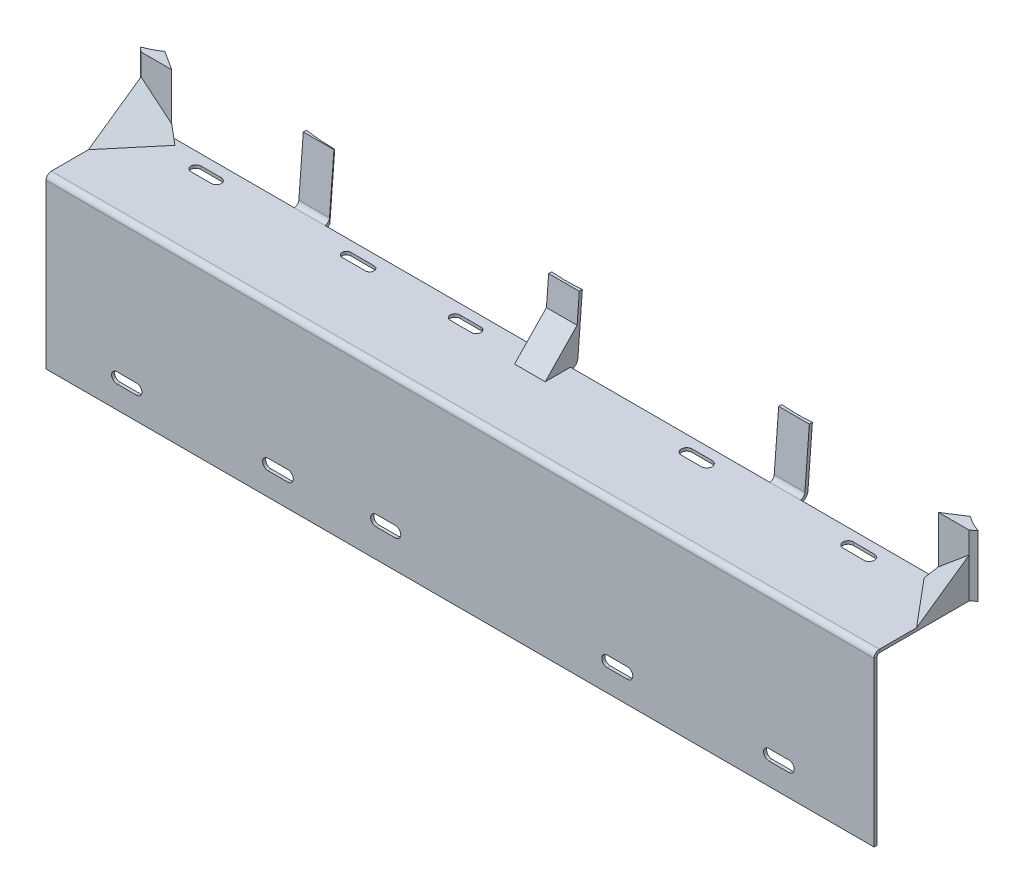
from build123d import *

# Parameters (mm, degrees)
ESQUISSE1_W                           = 270
ESQUISSE1_H                           = 55
T_LE_DE_BASE_PLI_E1_DEPTH             = 1
T_LE_PLI_E_SUR_AR_TE1_STRIP_W         = 5.4732
T_LE_PLI_E_SUR_AR_TE1_STRIP_H         = 1
T_LE_PLI_E_SUR_AR_TE1_STRIP_CUT_DEPTH = 270
T_LE_PLI_E_SUR_AR_TE1_DEPTH           = 270
BOSS_EXTRU_1_START                    = -135
BOSS_EXTRU_1_DEPTH                    = 5
ENL_V_MAT_EXTRU_2_DEPTH               = 283.872177276
BOSS_EXTRU_2_START                    = -10
BOSS_EXTRU_2_DEPTH                    = 10
BOSS_EXTRU_3_DEPTH                    = 20
ENL_V_MAT_EXTRU_7_DEPTH               = 286.069526522
BOSS_EXTRU_4_REACH                    = 239.035
BOSS_EXTRU_4_DIRECTION_2_REACH        = 239.035
R_P_TITION_LIN_AIRE7_COUNT            = 2
R_P_TITION_LIN_AIRE7_PITCH            = 80
R_P_TITION_LIN_AIRE8_COUNT            = 2
R_P_TITION_LIN_AIRE8_PITCH            = 75
ENL_V_MAT_EXTRU_8_DEPTH               = 285.398137951
ESQUISSE53_R                          = 1.75
ENL_V_MAT_EXTRU_9_DEPTH               = 280.175644717
ENL_V_MAT_EXTRU_11_DEPTH              = 280.104628006
ENL_V_MAT_EXTRU_12_DEPTH              = 10
ENL_V_MAT_EXTRU_13_DEPTH              = 280.175644717
ENL_V_MAT_EXTRU_14_DEPTH              = 280.175644717
ENL_V_MAT_EXTRU_15_DEPTH              = 280.175644717
ENL_V_MAT_EXTRU_16_DEPTH              = 280.175644717
ENL_V_MAT_EXTRU_17_DEPTH              = 280.104628006
ENL_V_MAT_EXTRU_18_DEPTH              = 280.104628006


# Sheet-metal steps are written as plain solids
with BuildPart() as part:
    # Esquisse1 → Tôle de base pliée1 (new body)
    with BuildSketch(Plane.XY):
        with Locations((135, -27.5)):
            Rectangle(ESQUISSE1_W, ESQUISSE1_H)
    extrude(amount=-T_LE_DE_BASE_PLI_E1_DEPTH)

    # Tôle pliée sur arête1 strip (across the edge) → Tôle pliée sur arête1 strip cut (cut)
    with BuildSketch(Plane(origin=(0, 0, -1), x_dir=(0, -1, 0), z_dir=(1, 0, 0))):
        with Locations((-1, -0.5)):
            Rectangle(T_LE_PLI_E_SUR_AR_TE1_STRIP_W, T_LE_PLI_E_SUR_AR_TE1_STRIP_H)
    extrude(amount=T_LE_PLI_E_SUR_AR_TE1_STRIP_CUT_DEPTH, mode=Mode.SUBTRACT)

    # Tôle pliée sur arête1 section (across the edge) → Tôle pliée sur arête1 (add)
    with BuildSketch(Plane(origin=(0, 0, -1), x_dir=(0, -1, 0), z_dir=(1, 0, 0))):
        with BuildLine():
            Line((0, 0.7366), (0, 30))
            Line((0, 30), (1, 30))
            Line((1, 30), (1, 0.7366))
            ThreePointArc((1, 0.7366), (1.215745145, 0.215745145), (1.7366, 0))
            Line((1.7366, 0), (1.7366, -1))
            ThreePointArc((1.7366, -1), (0.508638364, -0.491361636), (0, 0.7366))
        make_face()
    extrude(amount=T_LE_PLI_E_SUR_AR_TE1_DEPTH)

    # Esquisse22 → Boss.-Extru.1 (add, symmetric)
    with BuildSketch(Plane.ZY.offset(BOSS_EXTRU_1_START)):
        with BuildLine():
            Line((-31, 0), (-31, -1))
            ThreePointArc((-31, -1), (-32.659310922, -0.260972581), (-33.426330221, 1.385582617))
            Line((-33.426330221, 1.385582617), (-34.881510189, 20))
            Line((-34.881510189, 20), (-33.881510189, 20))
            Line((-33.881510189, 20), (-32.432404413, 1.463282654))
            ThreePointArc((-32.432404413, 1.463282654), (-31.981912691, 0.471537874), (-31, 0))
        make_face()
    boss_extru_1 = extrude(amount=BOSS_EXTRU_1_DEPTH, both=True)

    # Esquisse25 → Enlèv. mat.-Extru.2 (cut, through all)
    with BuildSketch(Plane(origin=(0, 22.588810811, -1.765877723), x_dir=(-1, 0, 0), z_dir=(0, -0.9969582781624381, 0.07793710030137713))):
        with BuildLine():
            Line((-140, 33.216668331), (-130, 33.216668331))
            ThreePointArc((-130, 33.216668331), (-135, 33.000088303), (-140, 33.216668331))
        make_face()
    enl_v_mat_extru_2 = extrude(amount=ENL_V_MAT_EXTRU_2_DEPTH, mode=Mode.SUBTRACT)

    # Esquisse47 → Boss.-Extru.2 (add)
    with BuildSketch(Plane(origin=(140, 0, 0), x_dir=(0, 0, -1), z_dir=(1, 0, 0)).offset(BOSS_EXTRU_2_START)):
        with BuildLine():
            Line((32.432404413, 1.463282654), (33.159380538, 10.762638976))
            Line((33.159380538, 10.762638976), (22.768887784, 0))
            Line((22.768887784, 0), (31, 0))
            ThreePointArc((31, 0), (31.981912691, 0.471537874), (32.432404413, 1.463282654))
        make_face()
    extrude(amount=BOSS_EXTRU_2_DEPTH)

    # Esquisse48 → Boss.-Extru.3 (add)
    with BuildSketch(Plane.XZ.offset(1)):
        Polygon((270, -31), (260, -31), (269.329315013, -36.998343541), (272.799848839, -33.349352128), align=None)
    boss_extru_3 = extrude(amount=-BOSS_EXTRU_3_DEPTH)

    # Esquisse50 → Enlèv. mat.-Extru.7 (cut, through all)
    with BuildSketch(Plane(origin=(0, 19, 0), x_dir=(1, 0, 0), z_dir=(0, 1, 0))):
        with BuildLine():
            ThreePointArc((266.294986337, 35.047402257), (268.836042932, 33.501000515), (271.562175684, 32.31082104))
            Line((271.562175684, 32.31082104), (272.799848839, 33.349352128))
            Line((272.799848839, 33.349352128), (269.329315013, 36.998343541))
            Line((269.329315013, 36.998343541), (266.294986337, 35.047402257))
        make_face()
    enl_v_mat_extru_7 = extrude(amount=-ENL_V_MAT_EXTRU_7_DEPTH, mode=Mode.SUBTRACT)

    # Boss.-Extru.4: up to this face of the body (flat: up to its plane)
    boss_extru_4_end = Plane(part.part.faces().sort_by_distance((263.147493169, 9, -33.023701128))[0])
    # Esquisse51 → Boss.-Extru.4 (add, up to the picked face)
    with BuildSketch(Plane(origin=(96.292975843, 0, 114.757499903), x_dir=(0.766044443118977, -1.5064271830750915e-15, -0.6427876096865406), z_dir=(0.6427876096865406, -2.6746298778743913e-15, 0.766044443118977)), mode=Mode.PRIVATE) as boss_extru_4_sk1:
        Polygon((215.725046737, 0), (226.758415542, 0), (226.758415542, 11.982155567), align=None)
    boss_extru_4_tool1 = split(extrude(boss_extru_4_sk1.sketch, amount=-BOSS_EXTRU_4_REACH, mode=Mode.PRIVATE), bisect_by=boss_extru_4_end, keep=Keep.BOTH, mode=Mode.PRIVATE)
    boss_extru_4 = boss_extru_4_tool1.solids().sort_by(Axis((267.18265, 3.994052, -28.635962), (-0.6427876096865406, 2.6746298778743913e-15, -0.766044443118977)))[0]
    add(boss_extru_4)

    # Boss.-Extru.4 direction 2: up to this face of the body (flat: up to its plane)
    boss_extru_4_direction_2_end = Plane(part.part.faces().sort_by_distance((270, -28.3683, -0.631347765))[0])
    # Esquisse51 → Boss.-Extru.4 direction 2 (add, up to the picked face)
    with BuildSketch(Plane(origin=(96.292975843, 0, 114.757499903), x_dir=(0.766044443118977, -1.5064271830750915e-15, -0.6427876096865406), z_dir=(0.6427876096865406, -2.6746298778743913e-15, 0.766044443118977)), mode=Mode.PRIVATE) as boss_extru_4_direction_2_sk1:
        Polygon((215.725046737, 0), (226.758415542, 0), (226.758415542, 11.982155567), align=None)
    boss_extru_4_direction_2_tool1 = split(extrude(boss_extru_4_direction_2_sk1.sketch, amount=BOSS_EXTRU_4_DIRECTION_2_REACH, mode=Mode.PRIVATE), bisect_by=boss_extru_4_direction_2_end, keep=Keep.BOTH, mode=Mode.PRIVATE)
    boss_extru_4_direction_2 = boss_extru_4_direction_2_tool1.solids().sort_by(Axis((267.18265, 3.994052, -28.635962), (0.6427876096865406, -2.6746298778743913e-15, 0.766044443118977)))[0]
    add(boss_extru_4_direction_2)

    # Symétrie1: Boss.-Extru.3, Enlèv. mat.-Extru.7, Boss.-Extru.4, Boss.-Extru.4 direction 2 across plane
    add(boss_extru_3.mirror(Plane(origin=(135, 0, 0), x_dir=(0, 0, 1), z_dir=(1, 0, 0))))
    add(enl_v_mat_extru_7.mirror(Plane(origin=(135, 0, 0), x_dir=(0, 0, 1), z_dir=(1, 0, 0))), mode=Mode.SUBTRACT)
    add(boss_extru_4.mirror(Plane(origin=(135, 0, 0), x_dir=(0, 0, 1), z_dir=(1, 0, 0))))
    add(boss_extru_4_direction_2.mirror(Plane(origin=(135, 0, 0), x_dir=(0, 0, 1), z_dir=(1, 0, 0))))

    # Répétition linéaire7: Boss.-Extru.1 ×2
    with Locations(*[(-i * R_P_TITION_LIN_AIRE7_PITCH, 0, 0) for i in range(1, R_P_TITION_LIN_AIRE7_COUNT)]):
        add(boss_extru_1)

    # Répétition linéaire8: Boss.-Extru.1, Enlèv. mat.-Extru.2 ×2
    with Locations(*[(i * R_P_TITION_LIN_AIRE8_PITCH, 0, 0) for i in range(1, R_P_TITION_LIN_AIRE8_COUNT)]):
        add(boss_extru_1)
        add(enl_v_mat_extru_2, mode=Mode.SUBTRACT)

    # Esquisse52 → Enlèv. mat.-Extru.8 (cut, through all)
    with BuildSketch(Plane(origin=(0, 22.588810811, -1.765877723), x_dir=(-1, 0, 0), z_dir=(0, -0.9969582781624381, 0.07793710030137713))):
        with BuildLine():
            Line((-60, 33.216668331), (-50, 33.216668331))
            ThreePointArc((-50, 33.216668331), (-54.986411491, 32.662553985), (-60, 32.474744168))
            Line((-60, 32.474744168), (-60, 33.216668331))
        make_face()
    extrude(amount=ENL_V_MAT_EXTRU_8_DEPTH, mode=Mode.SUBTRACT)

    # Esquisse53 → Enlèv. mat.-Extru.9 (cut, through all)
    with BuildSketch(Plane(origin=(0, 0, -1), x_dir=(-1, 0, 0), z_dir=(0, 0, -1))):
        with Locations((-241.94772672, -45.997712975)):
            Circle(ESQUISSE53_R)
    extrude(amount=-ENL_V_MAT_EXTRU_9_DEPTH, mode=Mode.SUBTRACT)

    # Esquisse55 → Enlèv. mat.-Extru.11 (cut, through all)
    with BuildSketch(Plane(origin=(0, -1, 0), x_dir=(-1, 0, 0), z_dir=(0, -1, 0))):
        with BuildLine():
            Line((-189.415802341, 27.756163785), (-182.903972207, 27.756163785))
            ThreePointArc((-182.903972207, 27.756163785), (-181.149560479, 26.001752057), (-182.903972207, 24.247340329))
            Line((-182.903972207, 24.247340329), (-189.415802341, 24.247340329))
            ThreePointArc((-189.415802341, 24.247340329), (-191.170214069, 26.001752057), (-189.415802341, 27.756163785))
        make_face()
    extrude(amount=-ENL_V_MAT_EXTRU_11_DEPTH, mode=Mode.SUBTRACT)

    # Esquisse56 → Enlèv. mat.-Extru.12 (cut)
    with BuildSketch(Plane(origin=(0, -1, 0), x_dir=(-1, 0, 0), z_dir=(0, -1, 0))):
        with BuildLine():
            Line((-235.450028966, 24.368691319), (-242.334409496, 24.325172349))
            ThreePointArc((-242.334409496, 24.325172349), (-244.055403534, 26.024544859), (-242.356031024, 27.745538897))
            Line((-242.356031024, 27.745538897), (-235.471650494, 27.789057866))
            ThreePointArc((-235.471650494, 27.789057866), (-233.750656456, 26.089685356), (-235.450028966, 24.368691319))
        make_face()
    extrude(amount=-ENL_V_MAT_EXTRU_12_DEPTH, mode=Mode.SUBTRACT)

    # Esquisse58 → Enlèv. mat.-Extru.13 (cut, through all)
    with BuildSketch(Plane(origin=(0, 0, -1), x_dir=(-1, 0, 0), z_dir=(0, 0, -1))):
        with BuildLine():
            Line((-242.216405398, -44.324651354), (-235.707046637, -44.324651354))
            ThreePointArc((-235.707046637, -44.324651354), (-233.957046637, -46.074651354), (-235.707046637, -47.824651354))
            Line((-235.707046637, -47.824651354), (-242.216405398, -47.824651354))
            ThreePointArc((-242.216405398, -47.824651354), (-243.966405398, -46.074651354), (-242.216405398, -44.324651354))
        make_face()
    extrude(amount=-ENL_V_MAT_EXTRU_13_DEPTH, mode=Mode.SUBTRACT)

    # Esquisse59 → Enlèv. mat.-Extru.14 (cut, through all)
    with BuildSketch(Plane(origin=(0, 0, -1), x_dir=(-1, 0, 0), z_dir=(0, 0, -1))):
        with BuildLine():
            Line((-182.982428428, -47.824252192), (-189.550139577, -47.824252192))
            ThreePointArc((-189.550139577, -47.824252192), (-191.314417599, -46.05997417), (-189.550139577, -44.295696148))
            Line((-189.550139577, -44.295696148), (-182.982428428, -44.295696148))
            ThreePointArc((-182.982428428, -44.295696148), (-181.218150406, -46.05997417), (-182.982428428, -47.824252192))
        make_face()
    extrude(amount=-ENL_V_MAT_EXTRU_14_DEPTH, mode=Mode.SUBTRACT)

    # Esquisse60 → Enlèv. mat.-Extru.15 (cut, through all)
    with BuildSketch(Plane(origin=(0, 0, -1), x_dir=(-1, 0, 0), z_dir=(0, 0, -1))):
        with BuildLine():
            Line((-113.907594656, -42.225773884), (-107.628470077, -42.225773884))
            ThreePointArc((-107.628470077, -42.225773884), (-105.862612951, -43.99163101), (-107.628470077, -45.757488137))
            Line((-107.628470077, -45.757488137), (-113.907594656, -45.757488137))
            ThreePointArc((-113.907594656, -45.757488137), (-115.673451783, -43.99163101), (-113.907594656, -42.225773884))
        make_face()
        with BuildLine():
            Line((-78.853527753, -43.99163101), (-72.39059006, -43.99163101))
            ThreePointArc((-72.39059006, -43.99163101), (-70.624732934, -45.757488137), (-72.39059006, -47.523345263))
            Line((-72.39059006, -47.523345263), (-78.853527753, -47.523345263))
            ThreePointArc((-78.853527753, -47.523345263), (-80.61938488, -45.757488137), (-78.853527753, -43.99163101))
        make_face()
    extrude(amount=-ENL_V_MAT_EXTRU_15_DEPTH, mode=Mode.SUBTRACT)

    # Esquisse61 → Enlèv. mat.-Extru.16 (cut, through all)
    with BuildSketch(Plane(origin=(0, 0, -1), x_dir=(-1, 0, 0), z_dir=(0, 0, -1))):
        with BuildLine():
            Line((-29.548031165, -44.224770126), (-23.087636761, -44.224770126))
            ThreePointArc((-23.087636761, -44.224770126), (-21.378424105, -45.933982781), (-23.087636761, -47.643195437))
            Line((-23.087636761, -47.643195437), (-29.548031165, -47.643195437))
            ThreePointArc((-29.548031165, -47.643195437), (-31.257243821, -45.933982781), (-29.548031165, -44.224770126))
        make_face()
    extrude(amount=-ENL_V_MAT_EXTRU_16_DEPTH, mode=Mode.SUBTRACT)

    # Esquisse62 → Enlèv. mat.-Extru.17 (cut, through all)
    with BuildSketch(Plane(origin=(0, -1, 0), x_dir=(-1, 0, 0), z_dir=(0, -1, 0))):
        with BuildLine():
            Line((-114.05308753, 27.739285007), (-107.181722005, 27.739285007))
            ThreePointArc((-107.181722005, 27.739285007), (-105.634768178, 26.192331181), (-107.181722005, 24.645377355))
            Line((-107.181722005, 24.645377355), (-114.05308753, 24.645377355))
            ThreePointArc((-114.05308753, 24.645377355), (-115.600041356, 26.192331181), (-114.05308753, 27.739285007))
        make_face()
        with BuildLine():
            Line((-79.348642563, 27.614355589), (-71.765351022, 27.614355589))
            ThreePointArc((-71.765351022, 27.614355589), (-70.343326614, 26.192331181), (-71.765351022, 24.770306773))
            Line((-71.765351022, 24.770306773), (-79.348642563, 24.770306773))
            ThreePointArc((-79.348642563, 24.770306773), (-80.770666971, 26.192331181), (-79.348642563, 27.614355589))
        make_face()
    extrude(amount=-ENL_V_MAT_EXTRU_17_DEPTH, mode=Mode.SUBTRACT)

    # Esquisse63 → Enlèv. mat.-Extru.18 (cut, through all)
    with BuildSketch(Plane(origin=(0, -1, 0), x_dir=(-1, 0, 0), z_dir=(0, -1, 0))):
        with BuildLine():
            Line((-29.578262658, 27.574166292), (-22.920553152, 27.574166292))
            ThreePointArc((-22.920553152, 27.574166292), (-21.293826526, 25.947439665), (-22.920553152, 24.320713038))
            Line((-22.920553152, 24.320713038), (-29.578262658, 24.320713038))
            ThreePointArc((-29.578262658, 24.320713038), (-31.204989284, 25.947439665), (-29.578262658, 27.574166292))
        make_face()
    extrude(amount=-ENL_V_MAT_EXTRU_18_DEPTH, mode=Mode.SUBTRACT)


solid = part.part
